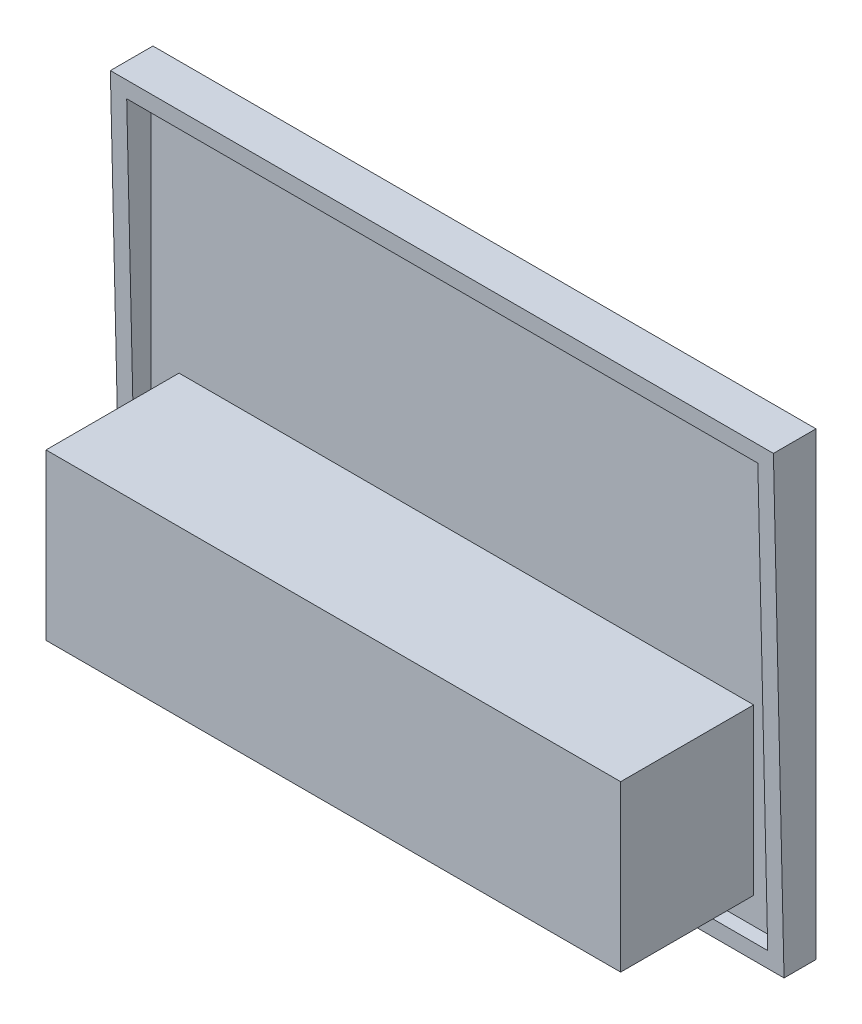
from build123d import *

# Parameters (mm, degrees)
ESQUISSE1_W                = 67
ESQUISSE1_H                = 44
BOSS_EXTRU_1_DEPTH         = 3
ENL_V_MAT_EXTRU_1_REACH    = 57.383
BOSS_EXTRU_2_DEPTH         = 62.30787925
ESQUISSE3_W                = 59.30787925
ESQUISSE3_H                = 40.132193811
ENL_V_MAT_EXTRU_2_DEPTH    = 54.306124294
ESQUISSE5_W                = 54
ESQUISSE5_H                = 15.5
BOSS_EXTRU_3_DEPTH         = 12.5
ENL_V_MAT_EXTRU_3_DEPTH    = 12.5
ENL_V_MAT_EXTRU_4_DEPTH    = 12.5
ESQUISSE8_W                = 4
ESQUISSE8_H                = 3
ENL_V_MAT_EXTRU_5_DEPTH    = 6
BOSS_EXTRU_4_DEPTH         = 4
ESQUISSE10_R               = 3
ESQUISSE10_R_2             = 1.25
ENL_V_MAT_EXTRU_6_DEPTH    = 8
CONG_1_R                   = 0.5
ESQUISSE11_R               = 2
ENL_V_MAT_EXTRU_7_DEPTH    = 0.1
ENL_V_MAT_EXTRU_8_DEPTH    = 0.1
R_P_TITION_LIN_AIRE1_COUNT = 2
R_P_TITION_LIN_AIRE1_PITCH = 45
ENL_V_MAT_EXTRU_9_DEPTH    = 0.1
ENL_V_MAT_EXTRU_10_DEPTH   = 0.1
ENL_V_MAT_EXTRU_11_DEPTH   = 0.1


# Read off the part's stored shape, not the designer's step: Dôme1
with BuildPart() as part:
    # Esquisse1 → Boss.-Extru.1 (new body)
    with BuildSketch(Plane.XY):
        with Locations((0, 22)):
            Rectangle(ESQUISSE1_W, ESQUISSE1_H)
    extrude(amount=BOSS_EXTRU_1_DEPTH)

    # Esquisse2 → Enlèv. mat.-Extru.1 (cut, up to next)
    with BuildSketch(Plane.XY.offset(3), mode=Mode.PRIVATE) as enl_v_mat_extru_1_sk1:
        Polygon((31.153939625, 43.193575137), (31.153939625, 0), (33.5, 0), (33.5, 44), (-33.5, 44), (-33.5, 0), (-31.153939625, 0), (-31.153939625, 43.193575137), align=None)
    enl_v_mat_extru_1_tool1 = extrude(enl_v_mat_extru_1_sk1.sketch, amount=-ENL_V_MAT_EXTRU_1_REACH, mode=Mode.PRIVATE) & part.part
    add(enl_v_mat_extru_1_tool1.solids().sort_by_distance((31.955501, 21.596788, 3))[0], mode=Mode.SUBTRACT)

    # Esquisse4 → Boss.-Extru.2 (add)
    with BuildSketch(Plane(origin=(31.153939625, 0, 0), x_dir=(0, 0, -1), z_dir=(1, 0, 0))):
        Polygon((-3, 0), (-4, 43.193575137), (-3, 43.193575137), align=None)
    extrude(amount=-BOSS_EXTRU_2_DEPTH)

    # Esquisse3 → Enlèv. mat.-Extru.2 (cut, through all)
    with BuildSketch(Plane.XY.offset(1.7)):
        with Locations((0, 21.566096906)):
            Rectangle(ESQUISSE3_W, ESQUISSE3_H)
    extrude(amount=ENL_V_MAT_EXTRU_2_DEPTH, mode=Mode.SUBTRACT)

    # Esquisse5 → Boss.-Extru.3 (add)
    with BuildSketch(Plane.XY.offset(1.7)):
        with Locations((0, 11.75)):
            Rectangle(ESQUISSE5_W, ESQUISSE5_H)
    extrude(amount=BOSS_EXTRU_3_DEPTH)

    # Esquisse6 → Enlèv. mat.-Extru.3 (cut)
    with BuildSketch(Plane(origin=(0, 0, 0), x_dir=(-1, 0, 0), z_dir=(0, 0, -1))):
        Polygon((-26.5, 16), (-18.5, 16), (-18.5, 9), (-20, 9), (-20, 7.5), (-20.8, 7.5), (-20.8, 5.5), (-24.2, 5.5), (-24.2, 7.5), (-25, 7.5), (-25, 9), (-26.5, 9), align=None)
        Polygon((20.8, 7.5), (20.8, 5.5), (24.2, 5.5), (24.2, 7.5), (25, 7.5), (25, 9), (26.5, 9), (26.5, 16), (18.5, 16), (18.5, 9), (20, 9), (20, 7.5), align=None)
    extrude(amount=-ENL_V_MAT_EXTRU_3_DEPTH, mode=Mode.SUBTRACT)

    # Esquisse7 → Enlèv. mat.-Extru.4 (cut)
    with BuildSketch(Plane(origin=(0, 0, 0), x_dir=(-1, 0, 0), z_dir=(0, 0, -1))):
        Polygon((-17, 16), (-5, 16), (-5, 9), (-7.6, 9), (-7.6, 7.5), (-8.9, 7.5), (-8.9, 5.5), (-13.1, 5.5), (-13.1, 7.5), (-14.4, 7.5), (-14.4, 9), (-17, 9), align=None)
    extrude(amount=-ENL_V_MAT_EXTRU_4_DEPTH, mode=Mode.SUBTRACT)

    # Esquisse8 → Enlèv. mat.-Extru.5 (cut)
    with BuildSketch(Plane.XY):
        with Locations((-10, 17.5)):
            Rectangle(ESQUISSE8_W, ESQUISSE8_H)
    extrude(amount=ENL_V_MAT_EXTRU_5_DEPTH, mode=Mode.SUBTRACT)

    # Esquisse9 → Boss.-Extru.4 (add)
    with BuildSketch(Plane(origin=(-12, 0, 0), x_dir=(0, 0, -1), z_dir=(1, 0, 0))):
        Polygon((0, 16), (5.5, 16), (6, 15.5), (5.5, 15), (6, 14.5), (5.5, 14), (6, 13.5), (5.5, 13), (6, 12.5), (5.5, 12), (6, 11.5), (5.5, 11), (6, 10.5), (5.5, 10), (0, 10), align=None)
    extrude(amount=BOSS_EXTRU_4_DEPTH)

    # Esquisse10 → Enlèv. mat.-Extru.6 (cut)
    with BuildSketch(Plane.XY):
        with Locations((-0.2, 8)):
            Circle(ESQUISSE10_R)
        with Locations((-0.2, 8)):
            Circle(ESQUISSE10_R_2, mode=Mode.SUBTRACT)
    extrude(amount=ENL_V_MAT_EXTRU_6_DEPTH, mode=Mode.SUBTRACT)

    # Congé1
    cong_1_edges = [part.edges().sort_by_distance(p)[0] for p in [
        (-1.45, 8, 0),
    ]]
    fillet(cong_1_edges, radius=CONG_1_R)

    # Esquisse11 → Enlèv. mat.-Extru.7 (cut)
    with BuildSketch(Plane(origin=(0, 0, 0), x_dir=(-1, 0, 0), z_dir=(0, 0, -1))):
        with Locations((0.2, 16)):
            Circle(ESQUISSE11_R)
    extrude(amount=-ENL_V_MAT_EXTRU_7_DEPTH, mode=Mode.SUBTRACT)

    # Dôme1 outline → Dôme1 (revolve)
    with BuildSketch(Plane(origin=(-0.2, 16, 0), x_dir=(1, 0, 0), z_dir=(0, -1, 0))):
        with BuildLine():
            Line((0, 0.100000002), (0, -1.1))
            ThreePointArc((0, -1.1), (1.16619038, -0.776983964), (2.000000001, 0.100000002))
            Line((2.000000001, 0.100000002), (0, 0.100000002))
        make_face()
    revolve(axis=Axis((-0.2, 16, 0), (0, 0, 1)))

    # Esquisse12 → Enlèv. mat.-Extru.8 (cut)
    # profile 1 of 3: a face of its own
    with BuildSketch(Plane(origin=(0, 0, 0), x_dir=(-1, 0, 0), z_dir=(0, 0, -1))):
        Polygon((-24.752431616, 19.116666667), (-24.40007785, 19.116666667), (-23.545270157, 17), (-23.951049404, 17), (-24.115565964, 17.434188034), (-25.037791525, 17.434188034), (-25.202308085, 17), (-25.60766332, 17), align=None)
        Polygon((-24.576466739, 18.548914931), (-24.893627529, 17.814102564), (-24.259305948, 17.814102564), align=None, mode=Mode.SUBTRACT)
    # profile 2 of 3: a face of its own
    with BuildSketch(Plane(origin=(0, 0, 0), x_dir=(-1, 0, 0), z_dir=(0, 0, -1))):
        with BuildLine():
            Line((-23.233197508, 19.116666667), (-22.853282978, 19.116666667))
            Line((-22.853282978, 19.116666667), (-22.853282978, 17.739476496))
            add(Edge.make_bspline(
                [(-22.853282978, 17.739476496), (-22.85326232, 17.725198385), (-22.85322242, 17.697620363), (-22.851224981, 17.658054929), (-22.849397187, 17.621686012), (-22.846099327, 17.588553427), (-22.841227258, 17.558643001), (-22.836509506, 17.5317626), (-22.830124494, 17.508393488), (-22.820528843, 17.48179332), (-22.805745094, 17.451906578), (-22.781589269, 17.420757931), (-22.753715513, 17.392330269), (-22.720307211, 17.36866816), (-22.682759234, 17.349527647), (-22.641277892, 17.335346645), (-22.595921658, 17.32746389), (-22.56456031, 17.326260443), (-22.548418528, 17.325641026)],
                knots=[0, 0, 0, 0, 1.155499968, 2.231836252, 3.205919964, 4.102923608, 4.924856345, 5.658536265, 6.31071849, 6.882491295, 7.94666036, 8.992281882, 10.060072772, 11.158554251, 12.289267114, 13.461410017, 14.693379945, 16, 16, 16, 16], degree=3))
            add(Edge.make_bspline(
                [(-22.548418528, 17.325641026), (-22.531269877, 17.326141436), (-22.49783291, 17.327117151), (-22.449739157, 17.336694848), (-22.405180021, 17.351945823), (-22.365098973, 17.373712851), (-22.329535899, 17.399804449), (-22.299432501, 17.429557047), (-22.275675011, 17.463029986), (-22.260190762, 17.493911322), (-22.25149712, 17.522334902), (-22.244980801, 17.547730292), (-22.240203619, 17.577694339), (-22.235869602, 17.611759089), (-22.233265192, 17.650277388), (-22.230441133, 17.692939466), (-22.22940609, 17.740037228), (-22.229229674, 17.772832285), (-22.229137679, 17.789933894)],
                knots=[0, 0, 0, 0, 1.261321664, 2.459363699, 3.594844139, 4.716940403, 5.803436589, 6.833651888, 7.818396249, 8.814403945, 9.360733334, 10.004355033, 10.743453831, 11.592799886, 12.532235708, 13.585170094, 14.740740724, 16, 16, 16, 16], degree=3))
            Line((-22.229137679, 17.789933894), (-22.229137679, 19.116666667))
            Line((-22.229137679, 19.116666667), (-21.849223149, 19.116666667))
            Line((-21.849223149, 19.116666667), (-21.849223149, 17.853959669))
            add(Edge.make_bspline(
                [(-21.849223149, 17.853959669), (-21.849275907, 17.828377285), (-21.849377356, 17.779184857), (-21.8509353, 17.708491876), (-21.854251881, 17.643925177), (-21.857037426, 17.585465894), (-21.862428411, 17.533192783), (-21.868044552, 17.48688262), (-21.875202807, 17.44669952), (-21.885853861, 17.400955944), (-21.904234425, 17.348283891), (-21.933866306, 17.287634306), (-21.97148206, 17.228254688), (-22.015942001, 17.170798255), (-22.066141342, 17.11742308), (-22.120967055, 17.070566585), (-22.179548097, 17.030931043), (-22.242496596, 16.999485591), (-22.309758981, 16.974960509), (-22.382000763, 16.958480889), (-22.459172679, 16.947347051), (-22.51247678, 16.946277509), (-22.539938293, 16.945726496)],
                knots=[0, 0, 0, 0, 1.170808336, 2.251350247, 3.235597562, 4.129743112, 4.929140599, 5.639994148, 6.264258765, 6.79612947, 7.788252245, 8.809469599, 9.879094798, 10.999557536, 12.129761673, 13.226370002, 14.293821979, 15.358369427, 16.438775801, 17.562147481, 18.744053101, 20, 20, 20, 20], degree=3))
            add(Edge.make_bspline(
                [(-22.539938293, 16.945726496), (-22.558184269, 16.946033825), (-22.594183205, 16.94664018), (-22.647125956, 16.951986643), (-22.698305525, 16.959865319), (-22.747625746, 16.971359497), (-22.795257799, 16.986207827), (-22.841189031, 17.004485088), (-22.88524875, 17.02608933), (-22.927190404, 17.050821843), (-22.966962379, 17.077565797), (-23.003311912, 17.107212597), (-23.037489874, 17.137569748), (-23.068508879, 17.16991481), (-23.096601907, 17.203908213), (-23.121711101, 17.239626998), (-23.143799157, 17.277067993), (-23.163421687, 17.316906069), (-23.180216657, 17.361166052), (-23.194375448, 17.411422287), (-23.206744901, 17.468462491), (-23.215937149, 17.532415173), (-23.224270895, 17.603069551), (-23.229545696, 17.680609691), (-23.232305182, 17.765037817), (-23.23289255, 17.823570087), (-23.233197508, 17.853959669)],
                knots=[0, 0, 0, 0, 1.001158378, 1.975264943, 2.917723546, 3.841610987, 4.75185031, 5.653588123, 6.552117133, 7.442167995, 8.324307438, 9.179605724, 10.014504199, 10.831958861, 11.636465792, 12.43274043, 13.225645099, 14.020104002, 14.867201867, 15.819789774, 16.883317127, 18.068162734, 19.364263498, 20.787406516, 22.332041935, 24, 24, 24, 24], degree=3))
            Line((-23.233197508, 17.853959669), (-23.233197508, 19.116666667))
        make_face()
    # profile 3 of 3: a face of its own
    with BuildSketch(Plane(origin=(0, 0, 0), x_dir=(-1, 0, 0), z_dir=(0, 0, -1))):
        Polygon((-21.490085195, 19.116666667), (-21.042328785, 19.116666667), (-20.600084527, 18.436975828), (-20.156992246, 19.116666667), (-19.708811824, 19.116666667), (-20.376206322, 18.093102297), (-19.664714602, 17), (-20.112471012, 17), (-20.600084527, 17.749652778), (-21.088970077, 17), (-21.537150499, 17), (-20.823962732, 18.093526309), align=None)
    enl_v_mat_extru_8 = extrude(amount=-ENL_V_MAT_EXTRU_8_DEPTH, mode=Mode.SUBTRACT)

    # Répétition linéaire1: Enlèv. mat.-Extru.8 ×2
    with Locations(*[(-i * R_P_TITION_LIN_AIRE1_PITCH, 0, 0) for i in range(1, R_P_TITION_LIN_AIRE1_COUNT)]):
        add(enl_v_mat_extru_8, mode=Mode.SUBTRACT)

    # Esquisse13 → Enlèv. mat.-Extru.9 (cut)
    # profile 1 of 3: a face of its own
    with BuildSketch(Plane(origin=(0, 0, 0), x_dir=(-1, 0, 0), z_dir=(0, 0, -1))):
        Polygon((-13.179563567, 17), (-13.179563567, 19.054654948), (-12.859357601, 19.054654948), (-12.859357601, 18.254140033), (-12.138894178, 18.254140033), (-12.138894178, 19.054654948), (-11.818688212, 19.054654948), (-11.818688212, 17), (-12.138894178, 17), (-12.138894178, 17.907250237), (-12.859357601, 17.907250237), (-12.859357601, 17), align=None)
    # profile 2 of 3: a face of its own
    with BuildSketch(Plane(origin=(0, 0, 0), x_dir=(-1, 0, 0), z_dir=(0, 0, -1))):
        with BuildLine():
            Line((-11.471798416, 19.054654948), (-10.781354302, 19.054654948))
            add(Edge.make_bspline(
                [(-10.781354302, 19.054654948), (-10.758700413, 19.05445163), (-10.715050485, 19.054059874), (-10.652179225, 19.052298023), (-10.594628788, 19.047986003), (-10.542357833, 19.042560153), (-10.49519761, 19.036367928), (-10.45339734, 19.027348918), (-10.416578453, 19.017774371), (-10.37460614, 19.002058369), (-10.327228163, 18.976823869), (-10.276329524, 18.936682937), (-10.22947052, 18.887749709), (-10.188664356, 18.829806367), (-10.153807228, 18.765565699), (-10.128700162, 18.69591296), (-10.113741708, 18.62181808), (-10.11187611, 18.571080242), (-10.110923061, 18.545160559)],
                knots=[0, 0, 0, 0, 1.124473672, 2.166656478, 3.121089245, 3.988001344, 4.77526076, 5.480116183, 6.109319004, 6.661554265, 7.701543192, 8.758483104, 9.865986798, 11.052779462, 12.265628083, 13.483214642, 14.714287386, 16, 16, 16, 16], degree=3))
            add(Edge.make_bspline(
                [(-10.110923061, 18.545160559), (-10.111773486, 18.52135084), (-10.11344502, 18.47455216), (-10.125163492, 18.406093392), (-10.145403297, 18.341263417), (-10.173192197, 18.280844255), (-10.207103015, 18.225793946), (-10.246611078, 18.177963936), (-10.29037049, 18.13690523), (-10.32373512, 18.116313037), (-10.340237229, 18.106128161)],
                knots=[0, 0, 0, 0, 1.102195328, 2.166396157, 3.204342149, 4.237991037, 5.237902837, 6.188656202, 7.104111395, 8, 8, 8, 8], degree=3))
            add(Edge.make_bspline(
                [(-10.340237229, 18.106128161), (-10.319001594, 18.096266576), (-10.276726114, 18.07663433), (-10.220135311, 18.034604105), (-10.17190342, 17.982166606), (-10.130424269, 17.921511871), (-10.097423225, 17.852360738), (-10.074305688, 17.775453013), (-10.059849566, 17.691682512), (-10.058336261, 17.633385717), (-10.0575554, 17.60330473)],
                knots=[0, 0, 0, 0, 0.914365049, 1.820299747, 2.735925076, 3.690630122, 4.685376883, 5.720815912, 6.823947219, 8, 8, 8, 8], degree=3))
            add(Edge.make_bspline(
                [(-10.0575554, 17.60330473), (-10.057875184, 17.584672507), (-10.058501638, 17.548172255), (-10.063435912, 17.494484654), (-10.072469649, 17.443184129), (-10.083708864, 17.393798899), (-10.099543899, 17.347022985), (-10.117660865, 17.302044945), (-10.139935089, 17.259458751), (-10.165305877, 17.21936953), (-10.192448599, 17.182021958), (-10.221552562, 17.148517818), (-10.251298254, 17.118284535), (-10.282957221, 17.092354766), (-10.31544513, 17.069661151), (-10.349291606, 17.050718976), (-10.384638346, 17.036012087), (-10.408957019, 17.028960585), (-10.42112259, 17.025433026)],
                knots=[0, 0, 0, 0, 1.22020471, 2.390363083, 3.526102761, 4.629955915, 5.703561803, 6.756598922, 7.802848293, 8.845806378, 9.861642828, 10.823224211, 11.750015592, 12.6357154, 13.499202288, 14.342595175, 15.170872714, 16, 16, 16, 16], degree=3))
            add(Edge.make_bspline(
                [(-10.42112259, 17.025433026), (-10.43111166, 17.023392204), (-10.453754351, 17.018766177), (-10.492159332, 17.013469513), (-10.538945232, 17.009743907), (-10.594097723, 17.005688265), (-10.657936044, 17.003653847), (-10.730196714, 17.001392651), (-10.810953131, 17.000223498), (-10.867520632, 17.000077016), (-10.89726219, 17)],
                knots=[0, 0, 0, 0, 0.512375785, 1.161426047, 1.946914314, 2.871141027, 3.940743941, 5.156722563, 6.50508681, 8, 8, 8, 8], degree=3))
            Line((-10.89726219, 17), (-11.471798416, 17))
            Line((-11.471798416, 17), (-11.471798416, 19.054654948))
        make_face()
        with BuildLine():
            Line((-11.15159245, 18.707765152), (-11.15159245, 18.254140033))
            Line((-11.15159245, 18.254140033), (-10.906434757, 18.254140033))
            add(Edge.make_bspline(
                [(-10.906434757, 18.254140033), (-10.888923216, 18.254092976), (-10.855567289, 18.254003341), (-10.80817794, 18.254603752), (-10.766060984, 18.254788028), (-10.729377621, 18.255819376), (-10.697952434, 18.256405806), (-10.67183888, 18.25783954), (-10.650813312, 18.258794729), (-10.638619186, 18.260202016), (-10.633342429, 18.260810991)],
                knots=[0, 0, 0, 0, 1.537921726, 2.929428249, 4.162267198, 5.236648627, 6.152403654, 6.922235861, 7.533619789, 8, 8, 8, 8], degree=3))
            add(Edge.make_bspline(
                [(-10.633342429, 18.260810991), (-10.618229409, 18.263572822), (-10.589259749, 18.268866887), (-10.548756565, 18.283544959), (-10.513850221, 18.304200473), (-10.483743425, 18.329907611), (-10.460397857, 18.361708305), (-10.442753232, 18.398329785), (-10.432860769, 18.440417201), (-10.431723035, 18.470061608), (-10.431129026, 18.485538876)],
                knots=[0, 0, 0, 0, 1.100193615, 2.108925541, 3.069258182, 3.994366649, 4.926956476, 5.876216083, 6.891177988, 8, 8, 8, 8], degree=3))
            add(Edge.make_bspline(
                [(-10.431129026, 18.485538876), (-10.431703756, 18.499475412), (-10.432800244, 18.526064002), (-10.440707225, 18.564069769), (-10.454502836, 18.597908586), (-10.473908308, 18.627132418), (-10.496871218, 18.651773246), (-10.522412717, 18.671693048), (-10.550566467, 18.686207963), (-10.576829023, 18.694040558), (-10.602232135, 18.698410551), (-10.628609496, 18.700398479), (-10.662064209, 18.703260238), (-10.702974052, 18.704408393), (-10.7511787, 18.706469085), (-10.806650866, 18.706837717), (-10.869323215, 18.708042659), (-10.91352179, 18.707861078), (-10.936871001, 18.707765152)],
                knots=[0, 0, 0, 0, 1.052351386, 2.007711197, 2.916182618, 3.795496935, 4.642249233, 5.450649971, 6.230038409, 7.020378978, 7.510527392, 8.174883014, 9.017067762, 10.046711282, 11.265182827, 12.661551488, 14.236365296, 16, 16, 16, 16], degree=3))
            Line((-10.936871001, 18.707765152), (-11.15159245, 18.707765152))
        make_face(mode=Mode.SUBTRACT)
        with BuildLine():
            Line((-11.15159245, 17.907250237), (-11.15159245, 17.346889796))
            Line((-11.15159245, 17.346889796), (-10.81304135, 17.346889796))
            add(Edge.make_bspline(
                [(-10.81304135, 17.346889796), (-10.795252134, 17.34700508), (-10.761339536, 17.347224851), (-10.713101765, 17.347904917), (-10.669869591, 17.349580577), (-10.631617999, 17.351921677), (-10.598277748, 17.35538082), (-10.569958862, 17.358772537), (-10.546752624, 17.36347745), (-10.522241144, 17.369776327), (-10.495971971, 17.382033071), (-10.467786055, 17.401343417), (-10.442316096, 17.426280262), (-10.419610916, 17.456028562), (-10.400515548, 17.490867495), (-10.387554883, 17.530597641), (-10.378770307, 17.57443046), (-10.378106933, 17.605202861), (-10.377761366, 17.621232929)],
                knots=[0, 0, 0, 0, 1.422074328, 2.710981391, 3.856134465, 4.880390511, 5.773592636, 6.5356346, 7.158764273, 7.665440749, 8.555459036, 9.45835037, 10.38545437, 11.392024878, 12.440928025, 13.544085548, 14.72065637, 16, 16, 16, 16], degree=3))
            add(Edge.make_bspline(
                [(-10.377761366, 17.621232929), (-10.378323798, 17.63766437), (-10.379404154, 17.669226952), (-10.387558064, 17.714479573), (-10.402322553, 17.754959816), (-10.422481168, 17.790894689), (-10.447553104, 17.821642936), (-10.476390361, 17.84775526), (-10.509265459, 17.868336706), (-10.540152459, 17.881021391), (-10.56862208, 17.888839366), (-10.595190664, 17.893385026), (-10.626547191, 17.898284877), (-10.662927538, 17.901116023), (-10.704172328, 17.904388549), (-10.750498962, 17.905606088), (-10.80177466, 17.90709507), (-10.837638846, 17.90719694), (-10.856402575, 17.907250237)],
                knots=[0, 0, 0, 0, 1.220775758, 2.344945564, 3.400211975, 4.408337778, 5.392209119, 6.335627291, 7.286926182, 8.259293687, 8.805475582, 9.477947255, 10.260788822, 11.163063353, 12.188028698, 13.335114355, 14.605762531, 16, 16, 16, 16], degree=3))
            Line((-10.856402575, 17.907250237), (-11.15159245, 17.907250237))
        make_face(mode=Mode.SUBTRACT)
    # profile 3 of 3: a face of its own
    with BuildSketch(Plane(origin=(0, 0, 0), x_dir=(-1, 0, 0), z_dir=(0, 0, -1))):
        Polygon((-9.950820078, 17), (-9.344179869, 18.074441112), (-9.897452417, 19.054654948), (-9.53680377, 19.054654948), (-9.163647078, 18.394230143), (-8.790907321, 19.054654948), (-8.42984174, 19.054654948), (-8.983114287, 18.074441112), (-8.376474079, 17), (-8.73753966, 17), (-9.163647078, 17.755069016), (-9.590171431, 17), align=None)
    extrude(amount=-ENL_V_MAT_EXTRU_9_DEPTH, mode=Mode.SUBTRACT)

    # Esquisse14 → Enlèv. mat.-Extru.10 (cut)
    with BuildSketch(Plane(origin=(0, 0, 0), x_dir=(-1, 0, 0), z_dir=(0, 0, -1))):
        with BuildLine():
            Line((-0.834136982, 2.676209027), (-1.154342948, 2.676209027))
            Line((-1.154342948, 2.676209027), (-1.154342948, 4.170503534))
            add(Edge.make_bspline(
                [(-1.154342948, 4.170503534), (-1.16987287, 4.154207319), (-1.200672339, 4.12188811), (-1.249672026, 4.076769289), (-1.300366378, 4.035172079), (-1.353089906, 3.996907891), (-1.407239328, 3.961613544), (-1.463499669, 3.929755744), (-1.521393871, 3.901267975), (-1.561306366, 3.88508277), (-1.581284236, 3.876981399)],
                knots=[0, 0, 0, 0, 1.033480345, 2.049633457, 3.05634389, 4.043072978, 5.039658923, 6.022790494, 7.010324124, 8, 8, 8, 8], degree=3))
            Line((-1.581284236, 3.876981399), (-1.581284236, 4.223871195))
            add(Edge.make_bspline(
                [(-1.581284236, 4.223871195), (-1.558256746, 4.234105634), (-1.510314814, 4.255413157), (-1.440178254, 4.29819423), (-1.369343155, 4.351768508), (-1.310567484, 4.403195598), (-1.264724621, 4.448950369), (-1.232059951, 4.484987894), (-1.20281665, 4.523051977), (-1.175715567, 4.561783898), (-1.151787084, 4.602291282), (-1.130661579, 4.643796491), (-1.111915939, 4.686570273), (-1.102137875, 4.716047215), (-1.097222873, 4.730863975)],
                knots=[0, 0, 0, 0, 1.256071058, 2.615068939, 4.086222451, 5.682781329, 6.506361962, 7.316438188, 8.106904776, 8.89922375, 9.673254088, 10.451495518, 11.221635059, 12, 12, 12, 12], degree=3))
            Line((-1.097222873, 4.730863975), (-0.834136982, 4.730863975))
            Line((-0.834136982, 4.730863975), (-0.834136982, 2.676209027))
        make_face()
        with BuildLine():
            Line((0.740209017, 3.023098823), (0.740209017, 2.676209027))
            Line((0.740209017, 2.676209027), (-0.407195694, 2.676209027))
            add(Edge.make_bspline(
                [(-0.407195694, 2.676209027), (-0.403158602, 2.71037408), (-0.395095387, 2.778611361), (-0.370679588, 2.878763107), (-0.337767458, 2.976602462), (-0.301728552, 3.056270499), (-0.265964447, 3.120596385), (-0.233971031, 3.173081074), (-0.195870341, 3.228930162), (-0.151707906, 3.288067977), (-0.102739756, 3.351370853), (-0.047882879, 3.418174854), (0.012577031, 3.488538808), (0.055240869, 3.536279932), (0.077282603, 3.560944782)],
                knots=[0, 0, 0, 0, 1.20268352, 2.402099407, 3.598367202, 4.810420478, 5.454599206, 6.172593709, 6.960183653, 7.818888272, 8.754527026, 9.759992126, 10.842728215, 12, 12, 12, 12], degree=3))
            add(Edge.make_bspline(
                [(0.077282603, 3.560944782), (0.094564756, 3.580219744), (0.127627057, 3.617094468), (0.174132054, 3.670492531), (0.21596316, 3.718510395), (0.251787272, 3.762139341), (0.282866715, 3.800467117), (0.308623939, 3.834077996), (0.329367856, 3.862680609), (0.340455478, 3.880676309), (0.345371713, 3.888655575)],
                knots=[0, 0, 0, 0, 1.465870871, 2.804341841, 4.009590698, 5.071600616, 6.000740577, 6.80347298, 7.469461756, 8, 8, 8, 8], degree=3))
            add(Edge.make_bspline(
                [(0.345371713, 3.888655575), (0.356781552, 3.909094814), (0.379053812, 3.948992662), (0.40224685, 4.012217872), (0.417406768, 4.075557068), (0.419144017, 4.118164772), (0.420003051, 4.139233421)],
                knots=[0, 0, 0, 0, 1.060288104, 2.069705834, 3.04550853, 4, 4, 4, 4], degree=3))
            add(Edge.make_bspline(
                [(0.420003051, 4.139233421), (0.4192652, 4.16028422), (0.417868401, 4.200134733), (0.40591423, 4.255812673), (0.385929771, 4.303694935), (0.357044216, 4.342571331), (0.321878648, 4.37308781), (0.281317733, 4.395356425), (0.235412684, 4.408548075), (0.203144802, 4.409940562), (0.186519534, 4.410658009)],
                knots=[0, 0, 0, 0, 1.245810787, 2.358399634, 3.353971925, 4.295778042, 5.200327805, 6.09189762, 7.016895116, 8, 8, 8, 8], degree=3))
            add(Edge.make_bspline(
                [(0.186519534, 4.410658009), (0.168491185, 4.409870203), (0.133936694, 4.408360235), (0.08533714, 4.394302291), (0.043155226, 4.371128644), (0.008588423, 4.337495483), (-0.019781432, 4.295476503), (-0.040263889, 4.24382572), (-0.054307099, 4.183524351), (-0.058226576, 4.140147648), (-0.060305898, 4.117135873)],
                knots=[0, 0, 0, 0, 0.999920937, 1.916523715, 2.784458762, 3.647604167, 4.570853193, 5.582015381, 6.717234977, 8, 8, 8, 8], degree=3))
            Line((-0.060305898, 4.117135873), (-0.380511864, 4.170503534))
            add(Edge.make_bspline(
                [(-0.380511864, 4.170503534), (-0.377830578, 4.193910583), (-0.3726292, 4.239317486), (-0.358856219, 4.304538193), (-0.342545037, 4.365161326), (-0.32212144, 4.420873146), (-0.297901568, 4.471746323), (-0.26980336, 4.517724779), (-0.238636961, 4.559582184), (-0.202829475, 4.595904293), (-0.163809752, 4.627681372), (-0.121841146, 4.655494783), (-0.076614671, 4.678752041), (-0.028524805, 4.698146), (0.022863693, 4.712504385), (0.077028046, 4.723496386), (0.134397227, 4.729696183), (0.173580287, 4.730468983), (0.193607427, 4.730863975)],
                knots=[0, 0, 0, 0, 1.257113927, 2.438652199, 3.554660598, 4.606291011, 5.601856267, 6.557471959, 7.478981492, 8.381416587, 9.2725261, 10.161501808, 11.064119884, 11.98308707, 12.924775989, 13.908409216, 14.930951759, 16, 16, 16, 16], degree=3))
            add(Edge.make_bspline(
                [(0.193607427, 4.730863975), (0.215601234, 4.730509778), (0.258231281, 4.729823247), (0.319985855, 4.720914124), (0.377805908, 4.708220498), (0.431122523, 4.688475922), (0.480867853, 4.664725125), (0.525600731, 4.633978091), (0.567156021, 4.599129994), (0.602784127, 4.557758737), (0.635216224, 4.514029124), (0.663062873, 4.467940572), (0.687173574, 4.420716544), (0.706386428, 4.37151254), (0.721344001, 4.320710694), (0.732123374, 4.268419213), (0.739184024, 4.214613622), (0.73986381, 4.178169961), (0.740209017, 4.159663228)],
                knots=[0, 0, 0, 0, 1.185802577, 2.298411505, 3.360827086, 4.373838454, 5.359924385, 6.327149754, 7.295159843, 8.277960573, 9.264958702, 10.230903902, 11.180079425, 12.122922977, 13.076886226, 14.034409875, 15.001838751, 16, 16, 16, 16], degree=3))
            add(Edge.make_bspline(
                [(0.740209017, 4.159663228), (0.739858668, 4.138657323), (0.739163119, 4.096954228), (0.732019826, 4.034853102), (0.721469483, 3.973617391), (0.705819051, 3.913164739), (0.685581375, 3.853187627), (0.660937924, 3.793166801), (0.631737685, 3.732905264), (0.60298361, 3.682975003), (0.577219422, 3.641493722), (0.554277206, 3.608337413), (0.52813112, 3.573242128), (0.499514208, 3.535617355), (0.467304392, 3.496187332), (0.432287143, 3.454482826), (0.394340023, 3.410699808), (0.367790533, 3.381068472), (0.354127344, 3.365819271)],
                knots=[0, 0, 0, 0, 1.112568374, 2.208785751, 3.308090549, 4.402946702, 5.513734595, 6.659701235, 7.83876403, 9.059051271, 9.71083511, 10.425746939, 11.194567613, 12.029688168, 12.930202216, 13.891926091, 14.915120021, 16, 16, 16, 16], degree=3))
            add(Edge.make_bspline(
                [(0.354127344, 3.365819271), (0.341475629, 3.351786959), (0.317354922, 3.325034121), (0.282950604, 3.286724334), (0.252831414, 3.251580038), (0.225533433, 3.220880251), (0.20224958, 3.193723742), (0.182386264, 3.170447965), (0.166827635, 3.150367634), (0.143261836, 3.121030178), (0.114960255, 3.079734703), (0.094871435, 3.041498643), (0.085204365, 3.023098823)],
                knots=[0, 0, 0, 0, 1.297038255, 2.472825099, 3.534584971, 4.474279189, 5.292832013, 5.990344774, 6.574432518, 7.036342243, 8.573839243, 10, 10, 10, 10], degree=3))
            Line((0.085204365, 3.023098823), (0.740209017, 3.023098823))
        make_face()
        Polygon((1.496945772, 2.676209027), (0.846944339, 4.730863975), (1.180075285, 4.730863975), (1.660801169, 3.210302572), (2.114843222, 4.730863975), (2.447974168, 4.730863975), (1.806311432, 2.676209027), align=None)
    extrude(amount=-ENL_V_MAT_EXTRU_10_DEPTH, mode=Mode.SUBTRACT)

    # Esquisse15 → Enlèv. mat.-Extru.11 (cut)
    # profile 1 of 5: a face of its own
    with BuildSketch(Plane(origin=(0, 0, 0), x_dir=(-1, 0, 0), z_dir=(0, 0, -1))):
        with BuildLine():
            add(Edge.make_bspline(
                [(8.199011465, 21.014819428), (8.199312367, 21.044568783), (8.199900555, 21.102721398), (8.205048799, 21.187846762), (8.213088164, 21.269017402), (8.225435193, 21.346020237), (8.239987515, 21.419260198), (8.259144463, 21.488137387), (8.280337244, 21.553452693), (8.306183283, 21.614289158), (8.333959233, 21.6716109), (8.364438195, 21.724792911), (8.396638252, 21.774531638), (8.431246269, 21.820207827), (8.467548717, 21.862575226), (8.505846825, 21.901113799), (8.546684717, 21.935365494), (8.5892353, 21.966518223), (8.634374896, 21.993590149), (8.681732883, 22.016923151), (8.731098667, 22.037149318), (8.782992719, 22.053407013), (8.837274107, 22.065725179), (8.893780337, 22.075004546), (8.952580709, 22.080494622), (8.992565929, 22.081054502), (9.012868295, 22.081338778)],
                knots=[0, 0, 0, 0, 1.413007263, 2.762078904, 4.049593578, 5.285819603, 6.465306206, 7.594367978, 8.679938674, 9.724528792, 10.731323562, 11.704103677, 12.63428548, 13.544001443, 14.424033479, 15.282963126, 16.12148102, 16.953398054, 17.7855508, 18.618122424, 19.459105522, 20.317248336, 21.19802291, 22.101006911, 23.035792388, 24, 24, 24, 24], degree=3))
            add(Edge.make_bspline(
                [(9.012868295, 22.081338778), (9.042244782, 22.080613084), (9.099904625, 22.079188698), (9.184168522, 22.065750225), (9.264405168, 22.04469341), (9.340429106, 22.014450021), (9.412100139, 21.975346564), (9.479604877, 21.927879716), (9.542967931, 21.871984116), (9.601604495, 21.807661681), (9.655130017, 21.735770454), (9.701007856, 21.655653423), (9.740392126, 21.568764996), (9.771772948, 21.474181003), (9.796964566, 21.372746202), (9.813860374, 21.263901086), (9.825216956, 21.148063033), (9.826212624, 21.068355423), (9.826725125, 21.027327474)],
                knots=[0, 0, 0, 0, 0.939885583, 1.844797075, 2.724414307, 3.591141889, 4.457241096, 5.332435845, 6.227757785, 7.156796134, 8.114335849, 9.091188046, 10.106791572, 11.163484353, 12.277169456, 13.449020478, 14.686932687, 16, 16, 16, 16], degree=3))
            add(Edge.make_bspline(
                [(9.826725125, 21.027327474), (9.826042259, 20.985885218), (9.824710531, 20.905064406), (9.813287283, 20.787325987), (9.794777917, 20.676477201), (9.768609088, 20.572656262), (9.734817331, 20.47574486), (9.693455485, 20.385805723), (9.644966505, 20.302348992), (9.605916446, 20.252394427), (9.586570651, 20.227646429)],
                knots=[0, 0, 0, 0, 1.16723241, 2.276340154, 3.328694564, 4.330478862, 5.288855569, 6.215552891, 7.11596681, 8, 8, 8, 8], degree=3))
            add(Edge.make_bspline(
                [(9.586570651, 20.227646429), (9.56867717, 20.207329377), (9.533380732, 20.167252235), (9.473027095, 20.115325873), (9.4082297, 20.071154888), (9.338283117, 20.035678541), (9.263987183, 20.007448577), (9.184819293, 19.987509609), (9.100913842, 19.975798411), (9.043480947, 19.974155889), (9.0141191, 19.97331617)],
                knots=[0, 0, 0, 0, 1.001181491, 1.974917111, 2.938062765, 3.897505349, 4.871145834, 5.87433439, 6.913280131, 8, 8, 8, 8], degree=3))
            add(Edge.make_bspline(
                [(9.0141191, 19.97331617), (8.984468543, 19.973914397), (8.926573364, 19.975082487), (8.842266639, 19.987773311), (8.762625214, 20.007003468), (8.687884315, 20.034673328), (8.618025078, 20.070359574), (8.553245689, 20.114194556), (8.49224645, 20.164992394), (8.457017312, 20.20491511), (8.43916594, 20.22514482)],
                knots=[0, 0, 0, 0, 1.094964679, 2.13800963, 3.143281602, 4.118328618, 5.076193384, 6.03488399, 7.004232895, 8, 8, 8, 8], degree=3))
            add(Edge.make_bspline(
                [(8.43916594, 20.22514482), (8.419850866, 20.249911772), (8.381009913, 20.299715984), (8.332256009, 20.382427284), (8.290915183, 20.471562759), (8.257266681, 20.567399434), (8.230928204, 20.669783634), (8.212484338, 20.778845138), (8.201016107, 20.894635327), (8.199691137, 20.974071115), (8.199011465, 21.014819428)],
                knots=[0, 0, 0, 0, 0.894191496, 1.798142236, 2.728299874, 3.690218715, 4.688169272, 5.737002699, 6.839146352, 8, 8, 8, 8], degree=3))
        make_face()
        with BuildLine():
            add(Edge.make_bspline(
                [(8.519217431, 21.028578279), (8.519556071, 20.999934614), (8.520211336, 20.944509293), (8.526982512, 20.864151336), (8.538016001, 20.789300515), (8.553861215, 20.719899209), (8.57372929, 20.655966089), (8.597776221, 20.597335485), (8.627141864, 20.544619819), (8.66057026, 20.497354242), (8.697207076, 20.455717397), (8.736215965, 20.419560854), (8.777329383, 20.388741483), (8.820715714, 20.36368001), (8.866354553, 20.344188445), (8.913986955, 20.33058624), (8.963770649, 20.32186925), (8.997682944, 20.320767194), (9.01495297, 20.320205966)],
                knots=[0, 0, 0, 0, 1.417627784, 2.743101411, 3.988491279, 5.160055516, 6.263228156, 7.299411243, 8.291037632, 9.243541693, 10.159958133, 11.031397084, 11.872096295, 12.698114263, 13.505705719, 14.322185685, 15.145563694, 16, 16, 16, 16], degree=3))
            add(Edge.make_bspline(
                [(9.01495297, 20.320205966), (9.03235324, 20.320818305), (9.066502141, 20.322020051), (9.116666191, 20.329979963), (9.164389074, 20.343797407), (9.20981088, 20.363239093), (9.253142302, 20.38783372), (9.293528239, 20.418792307), (9.332314158, 20.454306977), (9.368147727, 20.495912468), (9.401166108, 20.542854064), (9.429730241, 20.596016254), (9.453248693, 20.655164589), (9.472748671, 20.720054219), (9.488181837, 20.790710936), (9.498649015, 20.867249768), (9.505553385, 20.949511686), (9.506190269, 21.006326604), (9.506519159, 21.035666171)],
                knots=[0, 0, 0, 0, 0.856067668, 1.680075595, 2.491590685, 3.294271314, 4.105930429, 4.936043877, 5.792521075, 6.689215603, 7.631993153, 8.611021133, 9.650955643, 10.758472718, 11.941436728, 13.205325589, 14.55681326, 16, 16, 16, 16], degree=3))
            add(Edge.make_bspline(
                [(9.506519159, 21.035666171), (9.506125827, 21.064443891), (9.505362872, 21.120264645), (9.499319524, 21.201073431), (9.488295063, 21.275925534), (9.474178877, 21.34509421), (9.454783064, 21.408343907), (9.431874182, 21.466187213), (9.403651616, 21.51773081), (9.371871813, 21.56368129), (9.336291045, 21.603667246), (9.298111016, 21.638573753), (9.257542151, 21.668394013), (9.214305393, 21.693001021), (9.167989094, 21.711200232), (9.119352441, 21.724504051), (9.068083389, 21.733331428), (9.03291867, 21.734071088), (9.01495297, 21.734448982)],
                knots=[0, 0, 0, 0, 1.432762357, 2.779159561, 4.030754787, 5.197882272, 6.290139775, 7.320663351, 8.289843535, 9.209309419, 10.096549751, 10.948805523, 11.780590523, 12.598531546, 13.418314419, 14.250962417, 15.106414475, 16, 16, 16, 16], degree=3))
            add(Edge.make_bspline(
                [(9.01495297, 21.734448982), (8.996984709, 21.734078612), (8.961814977, 21.733353678), (8.910449557, 21.724397309), (8.861505121, 21.711415421), (8.815197057, 21.692373265), (8.771532639, 21.668020292), (8.730435373, 21.638158333), (8.691926694, 21.602838671), (8.656037629, 21.562285732), (8.62306137, 21.516262888), (8.595392055, 21.463613365), (8.571604916, 21.405552122), (8.552455629, 21.341422346), (8.537725229, 21.271529803), (8.527037697, 21.195755858), (8.520183638, 21.114176023), (8.519547034, 21.057778295), (8.519217431, 21.028578279)],
                knots=[0, 0, 0, 0, 0.8855316, 1.733273432, 2.565029, 3.379994694, 4.196545506, 5.026376759, 5.880638503, 6.769561942, 7.694238421, 8.666748973, 9.69692367, 10.785897995, 11.964055288, 13.217943305, 14.559585586, 16, 16, 16, 16], degree=3))
        make_face(mode=Mode.SUBTRACT)
    # profile 2 of 5: a face of its own
    with BuildSketch(Plane(origin=(0, 0, 0), x_dir=(-1, 0, 0), z_dir=(0, 0, -1))):
        Polygon((10.120247261, 20), (10.120247261, 22.054654948), (10.454629012, 22.054654948), (11.16091665, 20.682522352), (11.16091665, 22.054654948), (11.481122616, 22.054654948), (11.481122616, 20), (11.135066689, 20), (10.440453227, 21.340028613), (10.440453227, 20), align=None)
    # profile 3 of 5: a face of its own
    with BuildSketch(Plane(origin=(0, 0, 0), x_dir=(-1, 0, 0), z_dir=(0, 0, -1))):
        with BuildLine():
            add(Edge.make_bspline(
                [(8.445659419, 9.285353383), (8.482460263, 9.284400543), (8.555113465, 9.282519422), (8.661960106, 9.266838806), (8.764926601, 9.24128949), (8.863966389, 9.205774094), (8.958831484, 9.159330679), (9.049856509, 9.103275947), (9.136715415, 9.036551899), (9.218518142, 8.960715096), (9.294118616, 8.878245884), (9.35962647, 8.789453115), (9.415489165, 8.6966375), (9.461788316, 8.599550336), (9.497053738, 8.497519248), (9.521800942, 8.39106446), (9.537699795, 8.280216257), (9.539528408, 8.204743739), (9.540457763, 8.166386369)],
                knots=[0, 0, 0, 0, 1.014329547, 2.002516266, 2.970391464, 3.935626869, 4.897733899, 5.877609409, 6.878433252, 7.912639331, 8.949961323, 9.958554974, 10.949718813, 11.932905612, 12.9188844, 13.919928257, 14.942845884, 16, 16, 16, 16], degree=3))
            add(Edge.make_bspline(
                [(9.540457763, 8.166386369), (9.53946804, 8.128461197), (9.537517759, 8.05372843), (9.522450003, 7.943901737), (9.497286052, 7.838587302), (9.46261876, 7.737546742), (9.417159301, 7.641269464), (9.362385989, 7.54914075), (9.296853462, 7.462015578), (9.222951947, 7.379940702), (9.141592793, 7.30544014), (9.055420534, 7.239786648), (8.964833059, 7.184154357), (8.869962959, 7.138568749), (8.770606791, 7.103191437), (8.667009977, 7.078230173), (8.559178926, 7.063060709), (8.485848582, 7.061123167), (8.448627501, 7.060139708)],
                knots=[0, 0, 0, 0, 1.051557043, 2.072126891, 3.067553643, 4.050577992, 5.02905126, 6.015227836, 7.017913613, 8.04756643, 9.074058332, 10.072836633, 11.047628519, 12.017157415, 12.98668631, 13.966869689, 14.968021931, 16, 16, 16, 16], degree=3))
            add(Edge.make_bspline(
                [(8.448627501, 7.060139708), (8.409698714, 7.061021919), (8.333208969, 7.062755344), (8.221265884, 7.079239423), (8.114014736, 7.104070205), (8.012356496, 7.141128816), (7.915255863, 7.187455194), (7.823426262, 7.244508907), (7.736898554, 7.312195669), (7.656169078, 7.388781995), (7.583027977, 7.472584235), (7.518466608, 7.561113869), (7.464007662, 7.65369461), (7.419649144, 7.750369787), (7.384678672, 7.850538588), (7.360010976, 7.954811069), (7.34543918, 8.062937147), (7.343409413, 8.136378541), (7.34238084, 8.173594569)],
                knots=[0, 0, 0, 0, 1.067978421, 2.098431617, 3.099715153, 4.085208694, 5.062210972, 6.048429807, 7.046490867, 8.072918869, 9.098532598, 10.095778865, 11.076610158, 12.041847152, 13.011192615, 13.984257998, 14.978533688, 16, 16, 16, 16], degree=3))
            add(Edge.make_bspline(
                [(7.34238084, 8.173594569), (7.342703666, 8.198631564), (7.343345229, 8.248388528), (7.351073535, 8.322125809), (7.362200074, 8.394423837), (7.378655698, 8.46499436), (7.398645074, 8.534335218), (7.424544135, 8.601800971), (7.454024275, 8.668112338), (7.488469043, 8.732486099), (7.526768295, 8.794329961), (7.568556188, 8.853352197), (7.613937799, 8.90883914), (7.662766937, 8.961155429), (7.715211874, 9.009957184), (7.770582752, 9.055935263), (7.829953443, 9.097868324), (7.892024509, 9.136780455), (7.956446008, 9.171968022), (8.022955685, 9.201918625), (8.090183311, 9.228073978), (8.159026954, 9.248716938), (8.228748834, 9.265530414), (8.300093787, 9.276649453), (8.372417252, 9.284377546), (8.421187424, 9.285027332), (8.445659419, 9.285353383)],
                knots=[0, 0, 0, 0, 1.034744296, 2.056386356, 3.06226378, 4.057406941, 5.050368692, 6.043467995, 7.042652155, 8.049140477, 9.059438543, 10.048523776, 11.036952808, 12.020949711, 13.004946614, 13.997082645, 14.994316842, 16.007702937, 17.024872941, 18.026463647, 19.021641123, 20.005082605, 20.995858141, 21.984425357, 22.988620895, 24, 24, 24, 24], degree=3))
        make_face()
        with BuildLine():
            add(Edge.make_bspline(
                [(8.439723255, 8.905438853), (8.414956291, 8.9047743), (8.366076217, 8.903462738), (8.294378049, 8.893470408), (8.225545277, 8.877511522), (8.159959466, 8.85439527), (8.097336362, 8.824974148), (8.037564955, 8.789350958), (7.981472953, 8.746301192), (7.928312426, 8.698135999), (7.880290637, 8.644468906), (7.837861872, 8.586955488), (7.802355829, 8.525691792), (7.772619296, 8.461246944), (7.750234277, 8.392896278), (7.734290099, 8.321175193), (7.724213974, 8.245960109), (7.722943866, 8.194686084), (7.72229537, 8.168506428)],
                knots=[0, 0, 0, 0, 1.033739768, 2.040188636, 3.016340934, 3.979330865, 4.937572243, 5.900995986, 6.878200029, 7.884839167, 8.891893314, 9.879764717, 10.863503415, 11.843163062, 12.837761627, 13.859916423, 14.907309254, 16, 16, 16, 16], degree=3))
            add(Edge.make_bspline(
                [(7.72229537, 8.168506428), (7.723155177, 8.139493479), (7.724840255, 8.082632908), (7.736696671, 7.999686239), (7.756981819, 7.921351342), (7.786273177, 7.848011342), (7.822602147, 7.778851853), (7.867716961, 7.714720523), (7.920886974, 7.655233363), (7.961848721, 7.620502282), (7.982638586, 7.60287475)],
                knots=[0, 0, 0, 0, 1.078454662, 2.113592447, 3.107694534, 4.079536787, 5.043276885, 6.005368276, 6.987637804, 8, 8, 8, 8], degree=3))
            add(Edge.make_bspline(
                [(7.982638586, 7.60287475), (7.999669454, 7.589852207), (8.033347483, 7.56410052), (8.087104949, 7.531094451), (8.142464553, 7.502804957), (8.199844054, 7.479947381), (8.259122268, 7.461967995), (8.320291067, 7.449377327), (8.383263781, 7.441475594), (8.42584888, 7.440531188), (8.447355466, 7.440054237)],
                knots=[0, 0, 0, 0, 1.023928204, 2.024787132, 3.009472467, 3.9914905, 4.972207045, 5.96565515, 6.972602802, 8, 8, 8, 8], degree=3))
            add(Edge.make_bspline(
                [(8.447355466, 7.440054237), (8.471696561, 7.440724425), (8.51958843, 7.442043041), (8.589951898, 7.45191236), (8.657362236, 7.46861481), (8.722237936, 7.491528278), (8.784391923, 7.521318807), (8.843520435, 7.558046917), (8.899727141, 7.601261634), (8.952819942, 7.650059341), (9.001349272, 7.703937845), (9.043689498, 7.761758034), (9.080324455, 7.822245954), (9.109442617, 7.886257721), (9.132712017, 7.953189093), (9.148464298, 8.023336496), (9.158625544, 8.096410754), (9.15989601, 8.146140369), (9.160543233, 8.17147451)],
                knots=[0, 0, 0, 0, 1.026359118, 2.019393844, 2.989460624, 3.950973911, 4.916101784, 5.890408035, 6.881132271, 7.902007068, 8.92769091, 9.933912415, 10.920395702, 11.90457117, 12.894218921, 13.903490204, 14.931958862, 16, 16, 16, 16], degree=3))
            add(Edge.make_bspline(
                [(9.160543233, 8.17147451), (9.159873616, 8.196662973), (9.158555577, 8.24624262), (9.148668887, 8.319129005), (9.13207236, 8.388966727), (9.109090085, 8.455869839), (9.079742938, 8.51990393), (9.043452213, 8.58084382), (9.00034525, 8.638630593), (8.951414153, 8.692870455), (8.898155661, 8.742713414), (8.840977349, 8.785968042), (8.781479129, 8.823554939), (8.718295823, 8.852998995), (8.652720108, 8.876457013), (8.584351837, 8.893731834), (8.512932061, 8.903392541), (8.46434371, 8.904750669), (8.439723255, 8.905438853)],
                knots=[0, 0, 0, 0, 1.055025985, 2.07665775, 3.074803781, 4.057872707, 5.035505728, 6.020516407, 7.023567878, 8.050795229, 9.077271434, 10.074415901, 11.050397877, 12.019801805, 12.988065821, 13.964604439, 14.968634123, 16, 16, 16, 16], degree=3))
        make_face(mode=Mode.SUBTRACT)
    # profile 4 of 5: a face of its own
    with BuildSketch(Plane(origin=(0, 0, 0), x_dir=(-1, 0, 0), z_dir=(0, 0, -1))):
        Polygon((9.920372293, 9.231079879), (10.951568874, 9.231079879), (10.951568874, 8.851165349), (10.300286823, 8.851165349), (10.300286823, 8.444114067), (10.951568874, 8.444114067), (10.951568874, 8.064199537), (10.300286823, 8.064199537), (10.300286823, 7.114413212), (9.920372293, 7.114413212), align=None)
    # profile 5 of 5: a face of its own
    with BuildSketch(Plane(origin=(0, 0, 0), x_dir=(-1, 0, 0), z_dir=(0, 0, -1))):
        Polygon((11.331483404, 9.231079879), (12.362679985, 9.231079879), (12.362679985, 8.851165349), (11.711397934, 8.851165349), (11.711397934, 8.444114067), (12.362679985, 8.444114067), (12.362679985, 8.064199537), (11.711397934, 8.064199537), (11.711397934, 7.114413212), (11.331483404, 7.114413212), align=None)
    extrude(amount=-ENL_V_MAT_EXTRU_11_DEPTH, mode=Mode.SUBTRACT)


solid = part.part
